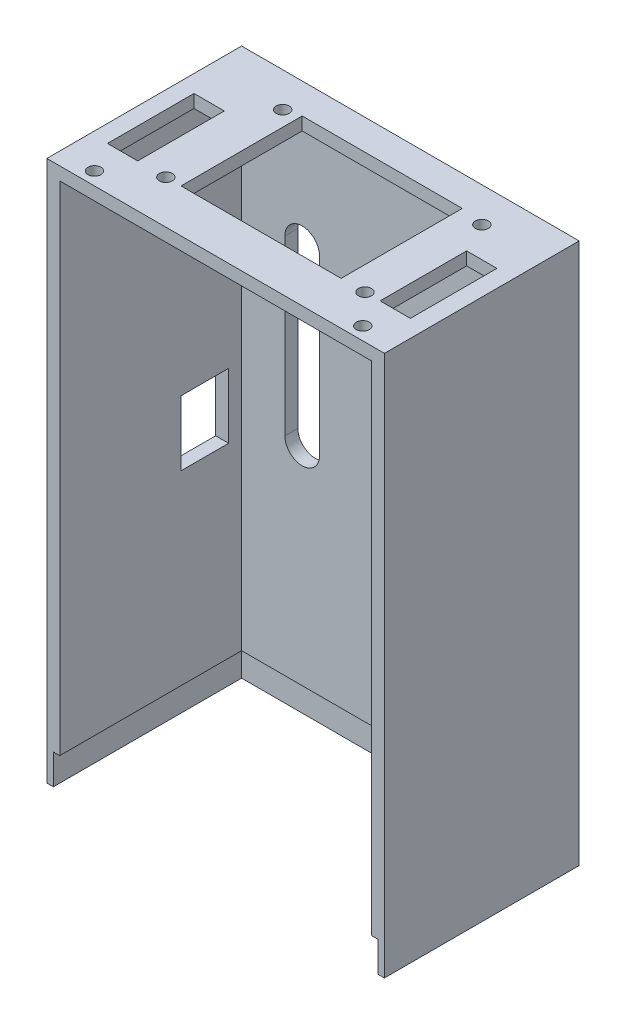
from build123d import *

# Parameters (mm, degrees)
SKETCH2_W           = 78
SKETCH2_H           = 250
BOSS_EXTRUDE1_DEPTH = 3
SKETCH3_W           = 78
SKETCH3_H           = 250
SKETCH3_W_2         = 72
SKETCH3_H_2         = 244
BOSS_EXTRUDE2_DEPTH = 42
SKETCH4_W           = 12
SKETCH4_H           = 12
SKETCH4_W_2         = 9.5
SKETCH4_H_2         = 11
CUT_EXTRUDE3_DEPTH  = 7
SKETCH6_W           = 11
SKETCH6_H           = 15
CUT_EXTRUDE4_DEPTH  = 6
SKETCH9_R           = 1.5
CUT_EXTRUDE6_DEPTH  = 257.994163358
CUT_EXTRUDE8_DEPTH  = 139.459380325
SKETCH16_R          = 1.5
CUT_EXTRUDE9_DEPTH  = 139.459380325
SKETCH19_W          = 37
SKETCH19_H          = 28
CUT_EXTRUDE11_DEPTH = 15
SKETCH25_W          = 7
SKETCH25_H          = 20
CUT_EXTRUDE16_DEPTH = 4
SKETCH27_R          = 1.5
CUT_EXTRUDE17_DEPTH = 10
CUT_EXTRUDE19_DEPTH = 138.513635688
SKETCH29_W          = 78
SKETCH29_H          = 125
CUT_EXTRUDE20_DEPTH = 138.513635688
SKETCH30_W          = 72
SKETCH30_H          = 7
CUT_EXTRUDE21_DEPTH = 1.5
SKETCH31_W          = 1.5
SKETCH31_H          = 7
CUT_EXTRUDE22_DEPTH = 43.5


with BuildPart() as part:
    # Sketch2 → Boss-Extrude1 (new body)
    with BuildSketch(Plane.XY):
        Rectangle(SKETCH2_W, SKETCH2_H)
    extrude(amount=BOSS_EXTRUDE1_DEPTH)

    # Sketch3 → Boss-Extrude2 (add)
    with BuildSketch(Plane.XY.offset(3)):
        Rectangle(SKETCH3_W, SKETCH3_H)
        Rectangle(SKETCH3_W_2, SKETCH3_H_2, mode=Mode.SUBTRACT)
    extrude(amount=BOSS_EXTRUDE2_DEPTH)

    # Sketch4 → Cut-Extrude3 (cut)
    with BuildSketch(Plane.XZ.offset(125)):
        with Locations((-10.5, 13)):
            Rectangle(SKETCH4_W, SKETCH4_H)
        with Locations((19.25, 12.5)):
            Rectangle(SKETCH4_W_2, SKETCH4_H_2)
    extrude(amount=-CUT_EXTRUDE3_DEPTH, mode=Mode.SUBTRACT)

    # Sketch6 → Cut-Extrude4 (cut)
    with BuildSketch(Plane.ZY.offset(39)):
        with Locations((11.5, 57.5)):
            Rectangle(SKETCH6_W, SKETCH6_H)
    extrude(amount=-CUT_EXTRUDE4_DEPTH, mode=Mode.SUBTRACT)

    # Sketch9 → Cut-Extrude6 (cut, through all)
    with BuildSketch(Plane.XZ.offset(125)):
        with Locations((-31, 42)):
            Circle(SKETCH9_R)
        with Locations((31, 42)):
            Circle(SKETCH9_R)
    extrude(amount=-CUT_EXTRUDE6_DEPTH, mode=Mode.SUBTRACT)

    # Sketch14 → Cut-Extrude8 (cut, through all)
    with BuildSketch(Plane(origin=(0, 0, 0), x_dir=(-1, 0, 0), z_dir=(0, 0, -1))):
        with BuildLine():
            Line((26, 95), (26, 55))
            ThreePointArc((26, 55), (22, 51), (18, 55))
            Line((18, 55), (18, 95))
            ThreePointArc((18, 95), (22, 99), (26, 95))
        make_face()
        with BuildLine():
            Line((-18, 95), (-18, 55))
            ThreePointArc((-18, 55), (-22, 51), (-26, 55))
            Line((-26, 55), (-26, 95))
            ThreePointArc((-26, 95), (-22, 99), (-18, 95))
        make_face()
        with BuildLine():
            Line((26, -35), (26, -75))
            ThreePointArc((26, -75), (22, -79), (18, -75))
            Line((18, -75), (18, -35))
            ThreePointArc((18, -35), (22, -31), (26, -35))
        make_face()
        with BuildLine():
            Line((-18, -35), (-18, -75))
            ThreePointArc((-18, -75), (-22, -79), (-26, -75))
            Line((-26, -75), (-26, -35))
            ThreePointArc((-26, -35), (-22, -31), (-18, -35))
        make_face()
    extrude(amount=-CUT_EXTRUDE8_DEPTH, mode=Mode.SUBTRACT)

    # Sketch16 → Cut-Extrude9 (cut, through all)
    with BuildSketch(Plane(origin=(0, 0, 0), x_dir=(-1, 0, 0), z_dir=(0, 0, -1))):
        with Locations((30, 115)):
            Circle(SKETCH16_R)
        with Locations((-30, 115)):
            Circle(SKETCH16_R)
        with Locations((30, -114)):
            Circle(SKETCH16_R)
        with Locations((-30, -114)):
            Circle(SKETCH16_R)
    extrude(amount=-CUT_EXTRUDE9_DEPTH, mode=Mode.SUBTRACT)

    # Sketch19 → Cut-Extrude11 (cut)
    with BuildSketch(Plane(origin=(0, 125, 0), x_dir=(1, 0, 0), z_dir=(0, 1, 0))):
        with Locations((0.5, -21)):
            Rectangle(SKETCH19_W, SKETCH19_H)
    extrude(amount=-CUT_EXTRUDE11_DEPTH, mode=Mode.SUBTRACT)

    # Sketch25 → Cut-Extrude16 (cut)
    with BuildSketch(Plane(origin=(0, 125, 0), x_dir=(1, 0, 0), z_dir=(0, 1, 0))):
        with Locations((-31.5, -25)):
            Rectangle(SKETCH25_W, SKETCH25_H)
        with Locations((31.5, -25)):
            Rectangle(SKETCH25_W, SKETCH25_H)
    extrude(amount=-CUT_EXTRUDE16_DEPTH, mode=Mode.SUBTRACT)

    # Sketch27 → Cut-Extrude17 (cut)
    with BuildSketch(Plane(origin=(0, 125, 0), x_dir=(1, 0, 0), z_dir=(0, 1, 0))):
        with Locations((-21.504408728, -8)):
            Circle(SKETCH27_R)
        with Locations((24.504408728, -8)):
            Circle(SKETCH27_R)
        with Locations((-21.504408728, -35)):
            Circle(SKETCH27_R)
        with Locations((24.504408728, -35)):
            Circle(SKETCH27_R)
    extrude(amount=-CUT_EXTRUDE17_DEPTH, mode=Mode.SUBTRACT)

    # Sketch28 → Cut-Extrude19 (cut, through all)
    with BuildSketch(Plane.XY.offset(3)):
        Polygon((-39, -125), (-39, 0), (-36, 0), (-36, -9.054539849), (36, -9.054539849), (36, 0), (39, 0), (39, -125), align=None)
    extrude(amount=CUT_EXTRUDE19_DEPTH, mode=Mode.SUBTRACT)

    # Sketch29 → Cut-Extrude20 (cut, through all)
    with BuildSketch(Plane.XY.offset(3)):
        with Locations((0, -62.5)):
            Rectangle(SKETCH29_W, SKETCH29_H)
    extrude(amount=-CUT_EXTRUDE20_DEPTH, mode=Mode.SUBTRACT)

    # Sketch30 → Cut-Extrude21 (cut)
    with BuildSketch(Plane.XY.offset(3)):
        with Locations((0, 3.5)):
            Rectangle(SKETCH30_W, SKETCH30_H)
    extrude(amount=-CUT_EXTRUDE21_DEPTH, mode=Mode.SUBTRACT)

    # Sketch31 → Cut-Extrude22 (cut)
    with BuildSketch(Plane.XY.offset(45)):
        with Locations((-36.75, 3.5)):
            Rectangle(SKETCH31_W, SKETCH31_H)
        with Locations((36.75, 3.5)):
            Rectangle(SKETCH31_W, SKETCH31_H)
    extrude(amount=-CUT_EXTRUDE22_DEPTH, mode=Mode.SUBTRACT)


solid = part.part
